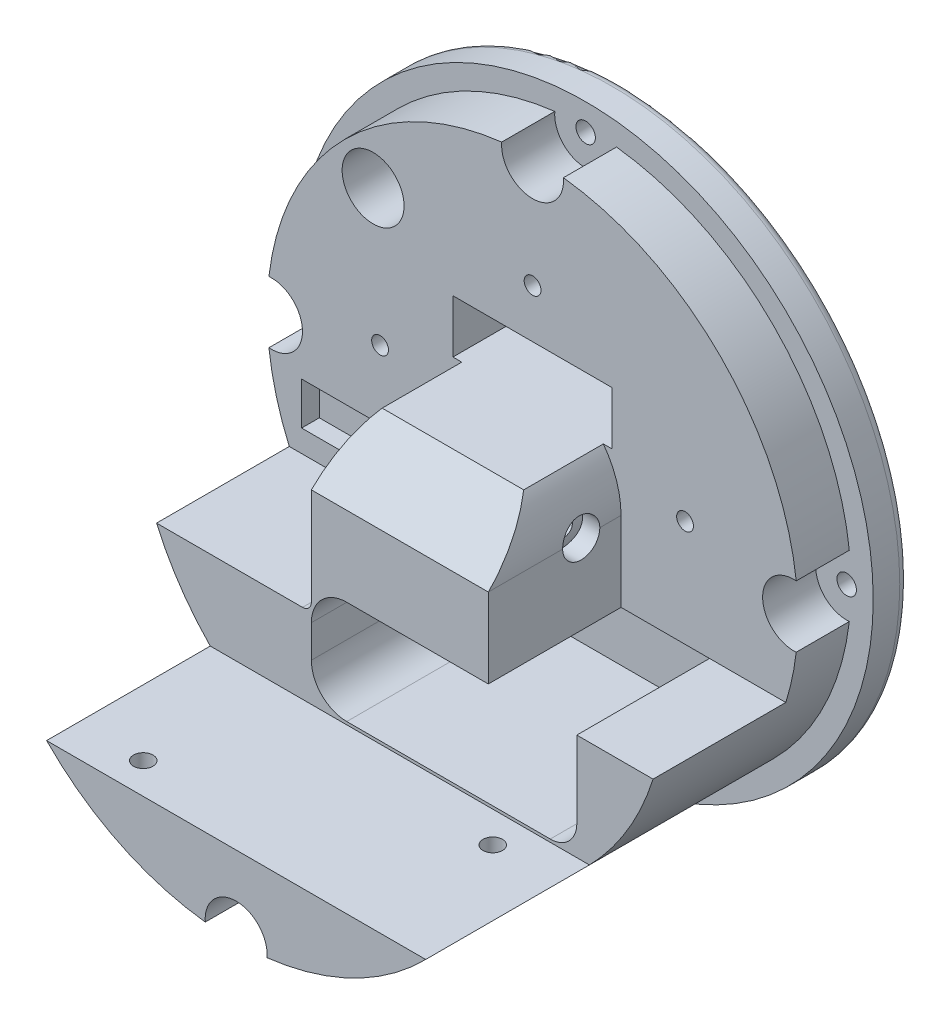
from build123d import *

# Parameters (mm, degrees)
SKETCH_3_R                = 30
EXTRUDE_1_DEPTH           = 10
SKETCH_8_R                = 10
EXTRUDE_4_DEPTH           = 15
SKETCH_9_R                = 4.05
CUT_EXTRUDE_2_DEPTH       = 23
CHAMFER_1_SIZE            = 4
EXTRUDE_5_DEPTH           = 15
EXTRUDE_6_DEPTH           = 18.5
CUT_EXTRUDE_3_DEPTH       = 15
SKETCH_13_R               = 1.1
CUT_EXTRUDE_4_DEPTH       = 22
EXTRUDE_7_DEPTH           = 15
CUT_EXTRUDE_5_DEPTH       = 22
SKETCH_16_R               = 32.5
SKETCH_16_R_2             = 30
EXTRUDE_8_DEPTH           = 4
CUT_EXTRUDE_6_DEPTH       = 15
FILLET_1_R                = 1
SKETCH_18_R               = 3.5
CUT_EXTRUDE_7_DEPTH       = 39.5
SKETCH_19_R               = 1.1
CUT_EXTRUDE_8_DEPTH       = 10
SKETCH_20_R               = 0.95
CUT_EXTRUDE_9_DEPTH       = 25
SKETCH_22_R               = 2.1
CUT_EXTRUDE_10_DEPTH      = 6
SKETCH_23_R               = 2.1
CUT_EXTRUDE_11_DEPTH      = 2
CUT_EXTRUDE_12_REACH      = 70.955
CUT_EXTRUDE_12_END_RADIUS = 8.05
SKETCH_24_R               = 2.1
CUT_EXTRUDE_13_REACH      = 70.955
CUT_EXTRUDE_13_END_RADIUS = 8.05
SKETCH_25_R               = 2.1
SKETCH_26_W               = 18
SKETCH_26_H               = 6
CUT_EXTRUDE_14_DEPTH      = 28
CUT_EXTRUDE_START         = -15
CUT_EXTRUDE_15_DEPTH      = 15
SKETCH_28_R               = 3.5
CUT_EXTRUDE_16_DEPTH      = 9
SKETCH_29_R               = 2
CUT_EXTRUDE_17_DEPTH      = 9
SKETCH_30_R               = 0.95
CUT_EXTRUDE_18_DEPTH      = 6
SKETCH_31_W               = 14.1
SKETCH_31_H               = 4.8
CUT_EXTRUDE_19_DEPTH      = 2
CUT_EXTRUDE_20_DEPTH      = 21
FILLET_2_R                = 1


with BuildPart() as part:
    # 草图3 → 凸台-拉伸1 (new body)
    with BuildSketch(Plane.XY):
        Circle(SKETCH_3_R)
    extrude(amount=EXTRUDE_1_DEPTH)

    # 草图8 → 凸台-拉伸4 (add)
    with BuildSketch(Plane.XY.offset(10)):
        Circle(SKETCH_8_R)
    extrude(amount=EXTRUDE_4_DEPTH)

    # 草图9 → 切除-拉伸2 (cut)
    with BuildSketch(Plane(origin=(0, 0, 0), x_dir=(-1, 0, 0), z_dir=(0, 0, -1))):
        Circle(SKETCH_9_R)
    extrude(amount=-CUT_EXTRUDE_2_DEPTH, mode=Mode.SUBTRACT)

    # 倒角1
    chamfer_1_edges = [part.edges().sort_by_distance(p)[0] for p in [
        (4.05, 0, 23),
    ]]
    chamfer(chamfer_1_edges, length=CHAMFER_1_SIZE)

    # 草图10 → 凸台-拉伸5 (add)
    with BuildSketch(Plane.XY.offset(10)):
        with BuildLine():
            Line((-28.618176043, -9), (-4.358898944, -9))
            ThreePointArc((-4.358898944, -9), (0, -10), (4.358898944, -9))
            Line((4.358898944, -9), (28.618176043, -9))
            ThreePointArc((28.618176043, -9), (0, -30), (-28.618176043, -9))
        make_face()
    extrude(amount=EXTRUDE_5_DEPTH)

    # 草图11 → 凸台-拉伸6 (add)
    with BuildSketch(Plane.XY.offset(25)):
        with BuildLine():
            Line((-21.424285286, -21), (21.424285286, -21))
            ThreePointArc((21.424285286, -21), (0, -30), (-21.424285286, -21))
        make_face()
    extrude(amount=EXTRUDE_6_DEPTH)

    # 草图12 → 切除-拉伸3 (cut)
    with BuildSketch(Plane.XY.offset(25)):
        with BuildLine():
            Line((-2.106, -15.674), (2.106, -15.674))
            ThreePointArc((2.106, -15.674), (4.606, -18.174), (2.106, -20.674))
            Line((2.106, -20.674), (-2.106, -20.674))
            ThreePointArc((-2.106, -20.674), (-4.606, -18.174), (-2.106, -15.674))
        make_face()
    extrude(amount=-CUT_EXTRUDE_3_DEPTH, mode=Mode.SUBTRACT)

    # 草图13 → 切除-拉伸4 (cut)
    with BuildSketch(Plane(origin=(0, -21, 0), x_dir=(1, 0, 0), z_dir=(0, 1, 0))):
        with Locations(Location((14, -28.5, 0), (0, 0, 180))):
            Circle(SKETCH_13_R)
        with Locations(Location((-14, -40, 0), (0, 0, 180))):
            Circle(SKETCH_13_R)
    extrude(amount=-CUT_EXTRUDE_4_DEPTH, mode=Mode.SUBTRACT)

    # 草图14 → 凸台-拉伸7 (add)
    with BuildSketch(Plane.XY.offset(10)):
        with BuildLine():
            Line((-10, 0), (-10, -9))
            Line((-10, -9), (-4.358898944, -9))
            ThreePointArc((-4.358898944, -9), (-8.473163206, -5.310885546), (-10, 0))
        make_face()
        with BuildLine():
            Line((10, 0), (10, -9))
            Line((10, -9), (4.358898944, -9))
            ThreePointArc((4.358898944, -9), (8.473163206, -5.310885546), (10, 0))
        make_face()
    extrude(amount=EXTRUDE_7_DEPTH)

    # 草图15 → 切除-拉伸5 (cut)
    with BuildSketch(Plane(origin=(10, 0, 0), x_dir=(0, 0, -1), z_dir=(1, 0, 0))):
        Polygon((-25, 0), (-15, 10), (-25, 10), align=None)
    extrude(amount=-CUT_EXTRUDE_5_DEPTH, mode=Mode.SUBTRACT)

    # 草图16 → 凸台-拉伸8 (add)
    with BuildSketch(Plane(origin=(0, 0, 0), x_dir=(-1, 0, 0), z_dir=(0, 0, -1))):
        Circle(SKETCH_16_R)
        Circle(SKETCH_16_R_2, mode=Mode.SUBTRACT)
    extrude(amount=-EXTRUDE_8_DEPTH)

    # 草图17 → 切除-拉伸6 (cut)
    with BuildSketch(Plane.XY.offset(25)):
        with BuildLine():
            Line((2.106, -15.674), (13, -15.674))
            ThreePointArc((13, -15.674), (15.121320344, -14.795320344), (16, -12.674))
            Line((16, -12.674), (16, -9))
            Line((16, -9), (20, -9))
            Line((20, -9), (20, -17.674))
            ThreePointArc((20, -17.674), (19.121320344, -19.795320344), (17, -20.674))
            Line((17, -20.674), (2.106, -20.674))
            Line((2.106, -20.674), (2.106, -15.674))
        make_face()
    extrude(amount=-CUT_EXTRUDE_6_DEPTH, mode=Mode.SUBTRACT)

    # 圆角1
    fillet_1_edges = [part.edges().sort_by_distance(p)[0] for p in [
        (32.5, 0, 0),
    ]]
    fillet(fillet_1_edges, radius=FILLET_1_R)

    # 草图18 → 切除-拉伸7 (cut)
    with BuildSketch(Plane.XY.offset(43.5)):
        with Locations((29.5, 0)):
            Circle(SKETCH_18_R)
        with Locations((0, 29.5)):
            Circle(SKETCH_18_R)
        with Locations((-29.5, 0)):
            Circle(SKETCH_18_R)
        with Locations((0, -29.5)):
            Circle(SKETCH_18_R)
    extrude(amount=-CUT_EXTRUDE_7_DEPTH, mode=Mode.SUBTRACT)

    # 草图19 → 切除-拉伸8 (cut)
    with BuildSketch(Plane(origin=(0, 0, 0), x_dir=(-1, 0, 0), z_dir=(0, 0, -1))):
        with Locations((0, 29.5)):
            Circle(SKETCH_19_R)
        with Locations((-29.5, 0)):
            Circle(SKETCH_19_R)
        with Locations((0, -29.5)):
            Circle(SKETCH_19_R)
        with Locations((29.5, 0)):
            Circle(SKETCH_19_R)
    extrude(amount=-CUT_EXTRUDE_8_DEPTH, mode=Mode.SUBTRACT)

    # 草图20 → 切除-拉伸9 (cut)
    with BuildSketch(Plane.ZY.offset(10)):
        with Locations((14.5, 0)):
            Circle(SKETCH_20_R)
    extrude(amount=-CUT_EXTRUDE_9_DEPTH, mode=Mode.SUBTRACT)

    # 草图22 → 切除-拉伸10 (cut)
    with BuildSketch(Plane(origin=(0, -30, 0), x_dir=(1, 0, 0), z_dir=(0, 1, 0))):
        with Locations(Location((14, -28.5, 0), (0, 0, 90))):
            Circle(SKETCH_22_R)
        with Locations(Location((-14, -40, 0), (0, 0, 90))):
            Circle(SKETCH_22_R)
    extrude(amount=CUT_EXTRUDE_10_DEPTH, mode=Mode.SUBTRACT)

    # 草图23 → 切除-拉伸11 (cut)
    with BuildSketch(Plane(origin=(0, 0, 0), x_dir=(-1, 0, 0), z_dir=(0, 0, -1))):
        with Locations((29.5, 0)):
            Circle(SKETCH_23_R)
        with Locations((0, -29.5)):
            Circle(SKETCH_23_R)
        with Locations((0, 29.5)):
            Circle(SKETCH_23_R)
        with Locations((-29.5, 0)):
            Circle(SKETCH_23_R)
    extrude(amount=-CUT_EXTRUDE_11_DEPTH, mode=Mode.SUBTRACT)

    # 切除-拉伸12: up to this cylinder (the profile starts outside it)
    cut_extrude_12_end = Plane(origin=(0, 0, 14.5), z_dir=(0, 0, -1)) * Cylinder(CUT_EXTRUDE_12_END_RADIUS, 159.01, mode=Mode.PRIVATE)
    # 草图24 → 切除-拉伸12 (cut, up to the surface)
    with BuildSketch(Plane.ZY.offset(10), mode=Mode.PRIVATE) as cut_extrude_12_sk1:
        with Locations((14.5, 0)):
            Circle(SKETCH_24_R)
    cut_extrude_12_tool1 = extrude(cut_extrude_12_sk1.sketch, amount=-CUT_EXTRUDE_12_REACH, mode=Mode.PRIVATE) - cut_extrude_12_end
    add(cut_extrude_12_tool1.solids().sort_by_distance((-10, 0, 14.5))[0], mode=Mode.SUBTRACT)

    # 切除-拉伸13: up to this cylinder (the profile starts outside it)
    cut_extrude_13_end = Plane(origin=(0, 0, 14.5), z_dir=(0, 0, -1)) * Cylinder(CUT_EXTRUDE_13_END_RADIUS, 159.01, mode=Mode.PRIVATE)
    # 草图25 → 切除-拉伸13 (cut, up to the surface)
    with BuildSketch(Plane(origin=(10, 0, 0), x_dir=(0, 0, -1), z_dir=(1, 0, 0)), mode=Mode.PRIVATE) as cut_extrude_13_sk1:
        with Locations(Location((-14.5, 0, 0), (0, 0, 180))):
            Circle(SKETCH_25_R)
    cut_extrude_13_tool1 = extrude(cut_extrude_13_sk1.sketch, amount=-CUT_EXTRUDE_13_REACH, mode=Mode.PRIVATE) - cut_extrude_13_end
    add(cut_extrude_13_tool1.solids().sort_by_distance((10, 0, 14.5))[0], mode=Mode.SUBTRACT)

    # 草图26 → 切除-拉伸14 (cut)
    with BuildSketch(Plane.XY.offset(25)):
        with Locations((0, 9)):
            Rectangle(SKETCH_26_W, SKETCH_26_H)
    extrude(amount=-CUT_EXTRUDE_14_DEPTH, mode=Mode.SUBTRACT)

    # 草图27 → 切除-拉伸15 (cut)
    with BuildSketch(Plane.XY.offset(25).offset(CUT_EXTRUDE_START)):
        with BuildLine():
            Line((-10, -9), (-28.618176043, -9))
            ThreePointArc((-28.618176043, -9), (-28.096883704, -10.514995297), (-27.49545417, -12))
            Line((-27.49545417, -12), (-10, -12))
            Line((-10, -12), (-10, -9))
        make_face()
    extrude(amount=CUT_EXTRUDE_15_DEPTH, mode=Mode.SUBTRACT)

    # 草图28 → 切除-拉伸16 (cut)
    with BuildSketch(Plane.XY.offset(10)):
        with Locations((-18.021648708, 18.021648708)):
            Circle(SKETCH_28_R)
    extrude(amount=-CUT_EXTRUDE_16_DEPTH, mode=Mode.SUBTRACT)

    # 草图29 → 切除-拉伸17 (cut)
    with BuildSketch(Plane.XY.offset(1)):
        with Locations((-18.021648708, 18.021648708)):
            Circle(SKETCH_29_R)
    extrude(amount=-CUT_EXTRUDE_17_DEPTH, mode=Mode.SUBTRACT)

    # 草图30 → 切除-拉伸18 (cut)
    with BuildSketch(Plane.XY.offset(10)):
        with Locations((0, 17.5)):
            Circle(SKETCH_30_R)
        with Locations((-17.234135678, 3.038843109)):
            Circle(SKETCH_30_R)
        with Locations((17.234135678, 3.038843109)):
            Circle(SKETCH_30_R)
    extrude(amount=-CUT_EXTRUDE_18_DEPTH, mode=Mode.SUBTRACT)

    # 草图31 → 切除-拉伸19 (cut)
    with BuildSketch(Plane.XY.offset(10)):
        with Locations((-19.05, -7.1)):
            Rectangle(SKETCH_31_W, SKETCH_31_H)
    extrude(amount=-CUT_EXTRUDE_19_DEPTH, mode=Mode.SUBTRACT)

    # 草图32 → 切除-拉伸20 (cut)
    with BuildSketch(Plane.XY.offset(25)):
        with BuildLine():
            Line((20, -9), (20, -17.674))
            ThreePointArc((20, -17.674), (19.121320344, -19.795320344), (17, -20.674))
            Line((17, -20.674), (-6, -20.674))
            ThreePointArc((-6, -20.674), (-8.828427125, -19.502427125), (-10, -16.674))
            Line((-10, -16.674), (-10, -13))
            ThreePointArc((-10, -13), (-8.828427125, -10.171572875), (-6, -9))
            Line((-6, -9), (20, -9))
        make_face()
    extrude(amount=-CUT_EXTRUDE_20_DEPTH, mode=Mode.SUBTRACT)

    # 圆角2
    fillet_2_edges = [part.edges().sort_by_distance(p)[0] for p in [
        (-10, -12, 17.5),
    ]]
    fillet(fillet_2_edges, radius=FILLET_2_R)


solid = part.part
